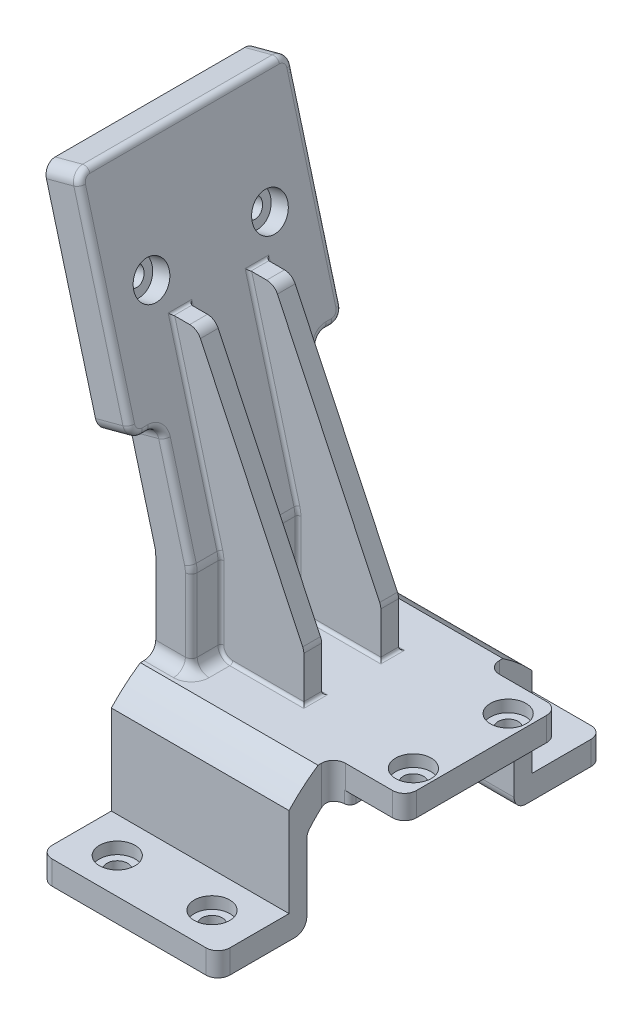
from build123d import *
from OCP.BRepFilletAPI import BRepFilletAPI_MakeChamfer

# Parameters (mm, degrees)
SKETCH_1_W              = 42
SKETCH_1_H              = 26
SKETCH_1_R              = 1.7
EXTRUDE_1_DEPTH         = 6
SKETCH_15_W             = 6
SKETCH_15_H             = 26
EXTRUDE_4_DEPTH         = 15
EXTRUDE_5_DEPTH         = 26
SKETCH_17_W             = 36
SKETCH_17_H             = 36
SKETCH_17_R             = 1.6
EXTRUDE_6_DEPTH         = 5.795554958
FILLET_3_R              = 2
SKETCH_18_R             = 3
CUT_EXTRUDE_4_DEPTH     = 3
SKETCH_19_R             = 3
CUT_EXTRUDE_5_DEPTH     = 3
FILLET_4_R              = 1
FILLET_6_R              = 5
EXTRUDE_7_DEPTH         = 2
FILLET_7_R              = 5
FILLET_8_R              = 5
SKETCH_21_W             = 30
SKETCH_21_H             = 7.5
EXTRUDE_8_DEPTH         = 6
SKETCH_23_W             = 30
SKETCH_23_H             = 3
EXTRUDE_9_DEPTH         = 17.25
SKETCH_24_W             = 30
SKETCH_24_H             = 4
EXTRUDE_10_DEPTH        = 12
EXTRUDE_11_DEPTH        = 30
FILLET_9_R              = 2
CUT_EXTRUDE_6_DEPTH     = 38
FILLET_11_R             = 2
SKETCH_29_R             = 1.75
CUT_EXTRUDE_7_DEPTH     = 38
SKETCH_30_R             = 3
CUT_EXTRUDE_8_DEPTH     = 2
FILLET_9_OF_MIRROR_2_R  = 2
FILLET_11_OF_MIRROR_2_R = 2
FILLET_14_R             = 2
SKETCH_31_W             = 26
SKETCH_31_H             = 2
CUT_EXTRUDE_9_DEPTH     = 9.2
DELETE_START            = 6
DELETE_FACE_3_OUTLINE_W = 27
DELETE_FACE_3_OUTLINE_H = 20
DELETE_FACE_3_DEPTH     = 13.385164807
SKETCH_34_W             = 26
SKETCH_34_H             = 3
EXTRUDE_12_DEPTH        = 46
DELETE_START_2          = -8
DELETE_FACE_4_DEPTH     = 16
FILLET_17_R             = 2
FILLET_15_R             = 1
CHAMFER_2_SIZE          = 38
CHAMFER_2_SIZE2         = 18
FILLET_18_R             = 2
FILLET_19_R             = 0.5
MOVE_FACE_1_BY          = 1
MOVE_FACE_1_2_BY        = 1


# Read off the part's stored shape, not the designer's step: 删除面3, 删除面4
with BuildPart() as part:
    # 草图1 → 凸台-拉伸1 (new body)
    with BuildSketch(Plane(origin=(0, 0, 0), x_dir=(1, 0, 0), z_dir=(0, 1, 0))):
        Rectangle(SKETCH_1_W, SKETCH_1_H)
        with Locations(Location((17.5, 8, 0), (0, 0, 270))):
            Circle(SKETCH_1_R, mode=Mode.SUBTRACT)
        with Locations(Location((17.5, -8, 0), (0, 0, 90))):
            Circle(SKETCH_1_R, mode=Mode.SUBTRACT)
    extrude(amount=EXTRUDE_1_DEPTH)

    # 草图15 → 凸台-拉伸4 (add)
    with BuildSketch(Plane(origin=(0, 6, 0), x_dir=(1, 0, 0), z_dir=(0, 1, 0))):
        with Locations((-18, 0)):
            Rectangle(SKETCH_15_W, SKETCH_15_H)
    extrude(amount=EXTRUDE_4_DEPTH)

    # 草图16 → 凸台-拉伸5 (add)
    with BuildSketch(Plane.XY.offset(13)):
        Polygon((-15, 21), (-20.0606666, 39.886664873), (-25.658742812, 38.386664873), (-21, 21), align=None)
    extrude(amount=-EXTRUDE_5_DEPTH)

    # 草图17 → 凸台-拉伸6 (add)
    with BuildSketch(Plane(origin=(-14.34326674, -3.84326674, 0), x_dir=(0, 0, 1), z_dir=(-0.9659258262890699, -0.2588190451025146, 0))):
        with Locations((0, 61.719642299)):
            Rectangle(SKETCH_17_W, SKETCH_17_H)
        with Locations(Location((10, 61.719642299, 0), (0, 0, 270))):
            Circle(SKETCH_17_R, mode=Mode.SUBTRACT)
        with Locations(Location((-10, 61.719642299, 0), (0, 0, 90))):
            Circle(SKETCH_17_R, mode=Mode.SUBTRACT)
    extrude(amount=-EXTRUDE_6_DEPTH)

    # 圆角3
    fillet_3_edges = [part.edges().sort_by_distance(p)[0] for p in [
        (-22.859704706, 39.136664873, 13),
        (-22.859704706, 39.136664873, -13),
        (-22.859704706, 39.136664873, 18),
        (-32.17719033, 73.90999462, 18),
        (-22.859704706, 39.136664873, -18),
        (-32.17719033, 73.90999462, -18),
    ]]
    fillet(fillet_3_edges, radius=FILLET_3_R)

    # 草图18 → 切除-拉伸4 (cut)
    with BuildSketch(Plane(origin=(-8.745190528, -2.34326674, 0), x_dir=(0, 0, -1), z_dir=(0.96592582628907, 0.25881904510251486, 0))):
        with Locations(Location((-10, 61.719642299, 0), (0, 0, 90))):
            Circle(SKETCH_18_R)
        with Locations(Location((10, 61.719642299, 0), (0, 0, 90))):
            Circle(SKETCH_18_R)
    extrude(amount=-CUT_EXTRUDE_4_DEPTH, mode=Mode.SUBTRACT)

    # 草图19 → 切除-拉伸5 (cut)
    with BuildSketch(Plane(origin=(0, 6, 0), x_dir=(1, 0, 0), z_dir=(0, 1, 0))):
        with Locations(Location((17.5, 8, 0), (0, 0, 270))):
            Circle(SKETCH_19_R)
        with Locations(Location((17.5, -8, 0), (0, 0, 270))):
            Circle(SKETCH_19_R)
    extrude(amount=-CUT_EXTRUDE_5_DEPTH, mode=Mode.SUBTRACT)

    # 圆角4
    fillet_4_edges = [part.edges().sort_by_distance(p)[0] for p in [
        (-15, 13.5, 13),
        (-15, 13.5, -13),
        (-17.271514255, 29.47740661, 13),
        (-17.271514255, 29.47740661, -13),
        (-20.0606666, 39.886664873, -15.5),
        (-20.0606666, 39.886664873, 15.5),
        (-24.719409412, 57.273329746, 18),
        (-29.378152224, 74.65999462, 0),
        (-24.719409412, 57.273329746, -18),
        (-29.226539538, 74.094168371, -17.414213562),
        (-20.212279287, 40.452491122, -17.414213562),
        (-20.212279287, 40.452491122, 17.414213562),
        (-29.226539538, 74.094168371, 17.414213562),
        (-19.909053914, 39.320838624, -13.585786438),
        (-19.909053914, 39.320838624, 13.585786438),
    ]]
    fillet(fillet_4_edges, radius=FILLET_4_R)

    # 圆角6
    # the kernel refuses this fillet: 5 mm, written as the material it adds along each edge
    with BuildSketch(Plane(origin=(-21, 21, 13), x_dir=(0, -1, 0), z_dir=(0, 0, -1))) as fillet_6_piece_1:
        with BuildLine():
            CenterArc((FILLET_6_R * 0.131652497587, FILLET_6_R), FILLET_6_R, 255, 15)
            Line((-FILLET_6_R * 0.127166547515, FILLET_6_R * 0.0340741737109), (0, 0))
            Line((0, 0), (FILLET_6_R * 0.131652497587, 0))
        make_face()
    extrude(amount=26)
    # the kernel refuses this fillet: 5 mm, written as the material it takes off along each edge
    with BuildSketch(Plane(origin=(-20, 20.341737513, -13), x_dir=(0.96592582628907, 0.25881904510251463, 0), z_dir=(-0.25881904510251463, 0.96592582628907, 0))) as fillet_6_2_piece_1:
        with BuildLine():
            CenterArc((4, -1), 1, 0, 90)
            Line((5, -1), (5, 0))
            Line((5, 0), (4, 0))
        make_face()
    revolve(axis=Axis((-20, 20.341737513, -13), (0, 0, -1)), revolution_arc=15, mode=Mode.SUBTRACT)
    with BuildSketch(Plane(origin=(-20, 20.341737513, 13), x_dir=(1, 0, 0), z_dir=(0, -1, 0))) as fillet_6_2_piece_2:
        with BuildLine():
            CenterArc((4, -1), 1, 0, 90)
            Line((5, -1), (5, 0))
            Line((5, 0), (4, 0))
        make_face()
    revolve(axis=Axis((-20, 20.341737513, 13), (0, 0, 1)), revolution_arc=15, mode=Mode.SUBTRACT)
    with BuildSketch(Plane(origin=(-15, 21.000000001, -13), x_dir=(-0.2588190451025144, 0.96592582628907, 0), z_dir=(0, 0, 1))) as fillet_6_2_piece_3:
        with BuildLine():
            CenterArc((FILLET_6_R * 0.131652497587, FILLET_6_R), FILLET_6_R, 255, 15)
            Line((-FILLET_6_R * 0.127166547515, FILLET_6_R * 0.0340741737109), (0, 0))
            Line((0, 0), (FILLET_6_R * 0.131652497587, 0))
        make_face()
    extrude(amount=26, mode=Mode.SUBTRACT)

    # 草图20 → 凸台-拉伸7 (add, symmetric)
    with BuildSketch(Plane.XY.offset(8)):
        Polygon((-15, 16), (10, 6), (-15, 6), align=None)
    extrude_7 = extrude(amount=EXTRUDE_7_DEPTH, both=True)

    # 镜向1: 凸台-拉伸7 across plane
    add(extrude_7.mirror(Plane(origin=(0, 0, 0), x_dir=(1, 0, 0), z_dir=(0, 0, -1))))

    # 圆角7
    fillet_7_edges = [part.edges().sort_by_distance(p)[0] for p in [
        (-15, 16, 8),
        (10, 6, 8),
        (-15, 16, -8),
        (10, 6, -8),
    ]]
    fillet(fillet_7_edges, radius=FILLET_7_R)

    # 圆角8
    fillet_8_edges = [part.edges().sort_by_distance(p)[0] for p in [
        (-15, 6, 0),
    ]]
    fillet(fillet_8_edges, radius=FILLET_8_R)

    # 草图21 → 凸台-拉伸8 (add)
    with BuildSketch(Plane(origin=(0, 6, 0), x_dir=(1, 0, 0), z_dir=(0, 1, 0))):
        with Locations((-6, -16.75)):
            Rectangle(SKETCH_21_W, SKETCH_21_H)
    extrude_8 = extrude(amount=-EXTRUDE_8_DEPTH)

    # 草图23 → 凸台-拉伸9 (add)
    with BuildSketch(Plane.XZ):
        with Locations((-6, 19)):
            Rectangle(SKETCH_23_W, SKETCH_23_H)
    extrude_9 = extrude(amount=EXTRUDE_9_DEPTH)

    # 草图24 → 凸台-拉伸10 (add)
    with BuildSketch(Plane.XY.offset(20.5)):
        with Locations((-6, -15.25)):
            Rectangle(SKETCH_24_W, SKETCH_24_H)
    extrude_10 = extrude(amount=EXTRUDE_10_DEPTH)

    # 草图26 → 凸台-拉伸11 (add)
    with BuildSketch(Plane.ZY.offset(21)):
        with BuildLine():
            Line((17.5, -3.107864376), (17.5, 0))
            Line((17.5, 0), (14.446020213, 0))
            ThreePointArc((14.446020213, 0), (16.048419147, -1.4798306), (17.5, -3.107864376))
        make_face()
    extrude_11 = extrude(amount=-EXTRUDE_11_DEPTH)

    # 圆角9
    fillet_9_edges = [part.edges().sort_by_distance(p)[0] for p in [
        (-6, -3.107864376, 17.5),
        (-6, 0, 14.446020213),
    ]]
    fillet(fillet_9_edges, radius=FILLET_9_R)

    # 草图28 → 切除-拉伸6 (cut)
    with BuildSketch(Plane.ZY.offset(21)):
        with BuildLine():
            Line((20.5, 1.822231123), (20.5, 6))
            Line((20.5, 6), (15.602483777, 6))
            ThreePointArc((15.602483777, 6), (18.171702504, 4.052329171), (20.5, 1.822231123))
        make_face()
    cut_extrude_6 = extrude(amount=-CUT_EXTRUDE_6_DEPTH, mode=Mode.SUBTRACT)

    # 圆角11
    fillet_11_edges = [part.edges().sort_by_distance(p)[0] for p in [
        (-6, -17.25, 17.5),
        (-21, -15.25, 32.5),
        (9, -15.25, 32.5),
    ]]
    fillet(fillet_11_edges, radius=FILLET_11_R)

    # 草图29 → 切除-拉伸7 (cut)
    with BuildSketch(Plane(origin=(0, -13.25, 0), x_dir=(1, 0, 0), z_dir=(0, 1, 0))):
        with Locations(Location((2, -26.5, 0), (0, 0, 270))):
            Circle(SKETCH_29_R)
        with Locations(Location((-14, -26.5, 0), (0, 0, 270))):
            Circle(SKETCH_29_R)
    cut_extrude_7 = extrude(amount=-CUT_EXTRUDE_7_DEPTH, mode=Mode.SUBTRACT)

    # 草图30 → 切除-拉伸8 (cut)
    with BuildSketch(Plane(origin=(0, -13.25, 0), x_dir=(1, 0, 0), z_dir=(0, 1, 0))):
        with Locations(Location((2, -26.5, 0), (0, 0, 270))):
            Circle(SKETCH_30_R)
        with Locations(Location((-14, -26.5, 0), (0, 0, 270))):
            Circle(SKETCH_30_R)
    cut_extrude_8 = extrude(amount=-CUT_EXTRUDE_8_DEPTH, mode=Mode.SUBTRACT)

    # 镜向2: 凸台-拉伸8, 凸台-拉伸9, 凸台-拉伸10, 凸台-拉伸11, 切除-拉伸6, 切除-拉伸7, 切除-拉伸8 across plane
    add(extrude_8.mirror(Plane.XY))
    add(extrude_9.mirror(Plane.XY))
    add(extrude_10.mirror(Plane.XY))
    add(extrude_11.mirror(Plane.XY))
    add(cut_extrude_6.mirror(Plane.XY), mode=Mode.SUBTRACT)
    add(cut_extrude_7.mirror(Plane.XY), mode=Mode.SUBTRACT)
    add(cut_extrude_8.mirror(Plane.XY), mode=Mode.SUBTRACT)

    # 圆角9 of 镜向2
    fillet_9_of_mirror_2_edges = [part.edges().sort_by_distance(p)[0] for p in [
        (-6, -3.107864376, -17.5),
        (-6, 0, -14.446020213),
    ]]
    fillet(fillet_9_of_mirror_2_edges, radius=FILLET_9_OF_MIRROR_2_R)

    # 圆角11 of 镜向2
    fillet_11_of_mirror_2_edges = [part.edges().sort_by_distance(p)[0] for p in [
        (-6, -17.25, -17.5),
        (-21, -15.25, -32.5),
        (9, -15.25, -32.5),
    ]]
    fillet(fillet_11_of_mirror_2_edges, radius=FILLET_11_OF_MIRROR_2_R)

    # 圆角14
    fillet_14_edges = [part.edges().sort_by_distance(p)[0] for p in [
        (9, 3, -13),
        (21, 3, -13),
        (9, 3, 13),
        (21, 3, 13),
    ]]
    fillet(fillet_14_edges, radius=FILLET_14_R)

    # 草图31 → 切除-拉伸9---昆改 (cut)
    with BuildSketch(Plane(origin=(21, 0, 0), x_dir=(0, 0, -1), z_dir=(1, 0, 0))):
        with Locations((0, 1)):
            Rectangle(SKETCH_31_W, SKETCH_31_H)
    extrude(amount=-CUT_EXTRUDE_9_DEPTH, mode=Mode.SUBTRACT)

    # Delete Face 3 outline → Delete Face 3 (cut)
    with BuildSketch(Plane(origin=(0, 0, 0), x_dir=(1, 0, 0), z_dir=(0, 1, 0)).offset(DELETE_START)):
        with Locations((-1.5, 0)):
            Rectangle(DELETE_FACE_3_OUTLINE_W, DELETE_FACE_3_OUTLINE_H)
    extrude(amount=DELETE_FACE_3_DEPTH, mode=Mode.SUBTRACT)

    # 草图34 → 凸台-拉伸12 (add)
    with BuildSketch(Plane(origin=(0, 6, 0), x_dir=(1, 0, 0), z_dir=(0, 1, 0))):
        with Locations((-14, -6.5)):
            Rectangle(SKETCH_34_W, SKETCH_34_H)
        with Locations((-14, 6.5)):
            Rectangle(SKETCH_34_W, SKETCH_34_H)
    extrude(amount=EXTRUDE_12_DEPTH)

    # Delete Face 4 outline → Delete Face 4 (cut)
    with BuildSketch(Plane.XY.offset(DELETE_START_2)):
        with BuildLine():
            Line((-21.170370869, 21.635832738), (-27, 43.392304845))
            Line((-27, 43.392304845), (-27, 6))
            Line((-27, 6), (-21, 6))
            Line((-21, 6), (-21, 20.341737512))
            ThreePointArc((-21, 20.341737512), (-21.042775693, 20.994368473), (-21.170370869, 21.635832738))
        make_face()
    extrude(amount=DELETE_FACE_4_DEPTH, mode=Mode.SUBTRACT)

    # 圆角17
    fillet_17_edges = [part.edges().sort_by_distance(p)[0] for p in [
        (-15, 6, 10),
        (-15.292893219, 6, -12.707106781),
        (-15.292893219, 6, 12.707106781),
        (-18.5, 6, 13),
        (-18.5, 6, -13),
        (-15, 6, 0),
        (-15, 6, -10),
    ]]
    fillet(fillet_17_edges, radius=FILLET_17_R)

    # 圆角15
    # the kernel refuses this fillet: 1 mm, written as the material it takes off along each edge
    with BuildSketch(Plane(origin=(11.8, 2, -13), x_dir=(-0.9999886370597283, 0, -0.004767153388247486), z_dir=(0, -1, 0)), Plane(origin=(11.8, -2.483314774, 13), x_dir=(-0.9999886370597282, 0, 0.004767153388253213), z_dir=(0, 1, 0))) as fillet_15_piece_1:
        with BuildLine():
            CenterArc((0.9952533, -0.998081776), FILLET_15_R, 93.549414925, 86.177446271)
            Line((-0.004735337, -0.993314622), (-0.104734201, -0.992837907))
            Line((-0.104734201, -0.992837907), (-0.099998864, 0.000476715))
            Line((-0.099998864, 0.000476715), (0.000476715, 0.099998864))
            ThreePointArc((0.000476715, 0.099998864), (0.800467625, 0.096185141), (0.927153003, 0.099808178))
            Line((0.927153003, 0.099808178), (0.933343939, 0))
        make_face()
    extrude(amount=4.483314774, mode=Mode.SUBTRACT)

    # 倒角2: one chamfer whose edges measure the first distance from different faces: ONE call of the kernel's chamfer builder (chamfer() names one face for all edges)
    chamfer_2_edges_1 = [part.edges().sort_by_distance(p)[0] for p in [
        (-1, 52, 6.5),
    ]]
    chamfer_2_side_1 = [part.faces().sort_by_distance(p)[0] for p in [
        (-1, 29, 6.5),
    ]]
    chamfer_2_edges_2 = [part.edges().sort_by_distance(p)[0] for p in [
        (-1, 52, -6.5),
    ]]
    chamfer_2_side_2 = [part.faces().sort_by_distance(p)[0] for p in [
        (-1, 29, -6.5),
    ]]
    chamfer_2 = BRepFilletAPI_MakeChamfer(part.part.solid().wrapped)
    for e in chamfer_2_edges_1:
        chamfer_2.Add(CHAMFER_2_SIZE, CHAMFER_2_SIZE2, e.wrapped, chamfer_2_side_1[0].wrapped)  # the first distance lies on this face
    for e in chamfer_2_edges_2:
        chamfer_2.Add(CHAMFER_2_SIZE, CHAMFER_2_SIZE2, e.wrapped, chamfer_2_side_2[0].wrapped)  # the first distance lies on this face
    add(Compound.cast(chamfer_2.Shape()), mode=Mode.REPLACE)

    # 圆角18
    fillet_18_edges = [part.edges().sort_by_distance(p)[0] for p in [
        (-19, 52, -6.5),
        (-1, 14, -6.5),
        (-19, 52, 6.5),
        (-1, 14, 6.5),
    ]]
    fillet(fillet_18_edges, radius=FILLET_18_R)

    # 圆角19
    fillet_19_edges = [part.edges().sort_by_distance(p)[0] for p in [
        (-23.306424965, 52, 6.5),
        (-15, 14.170868757, 8),
        (-7, 6, 5),
        (-15.042775693, 20.994368474, 8),
        (-19.238397917, 36.817916369, 8),
        (-1, 6, 6.5),
        (-19.238397917, 36.817916369, 5),
        (-15.042775693, 20.994368474, 5),
        (-23.306424965, 52, -6.5),
        (-15, 14.170868757, -5),
        (-7, 6, -8),
        (-15.042775693, 20.994368474, -5),
        (-19.238397917, 36.817916369, -5),
        (-1, 6, -6.5),
        (-19.238397917, 36.817916369, -8),
        (-15.042775693, 20.994368474, -8),
        (-7, 6, -5),
        (-7, 6, 8),
        (-15, 14.170868757, -8),
        (-14.414213562, 6.585786438, -8),
        (-15, 14.170868757, 5),
        (-14.414213562, 6.585786438, -5),
        (-14.414213562, 6.585786438, 5),
        (-14.414213562, 6.585786438, 8),
    ]]
    fillet(fillet_19_edges, radius=FILLET_19_R)

    # Move Face 1: a face moved outward by 1.0
    extrude(part.faces().sort_by_distance((17.5, 3, 10.4))[0], amount=MOVE_FACE_1_BY, dir=(0, 1, 0))

    # Move Face 1 2: a face moved outward by 1.0
    extrude(part.faces().sort_by_distance((17.5, 3, -5.6))[0], amount=MOVE_FACE_1_2_BY, dir=(0, 1, 0))


solid = part.part
